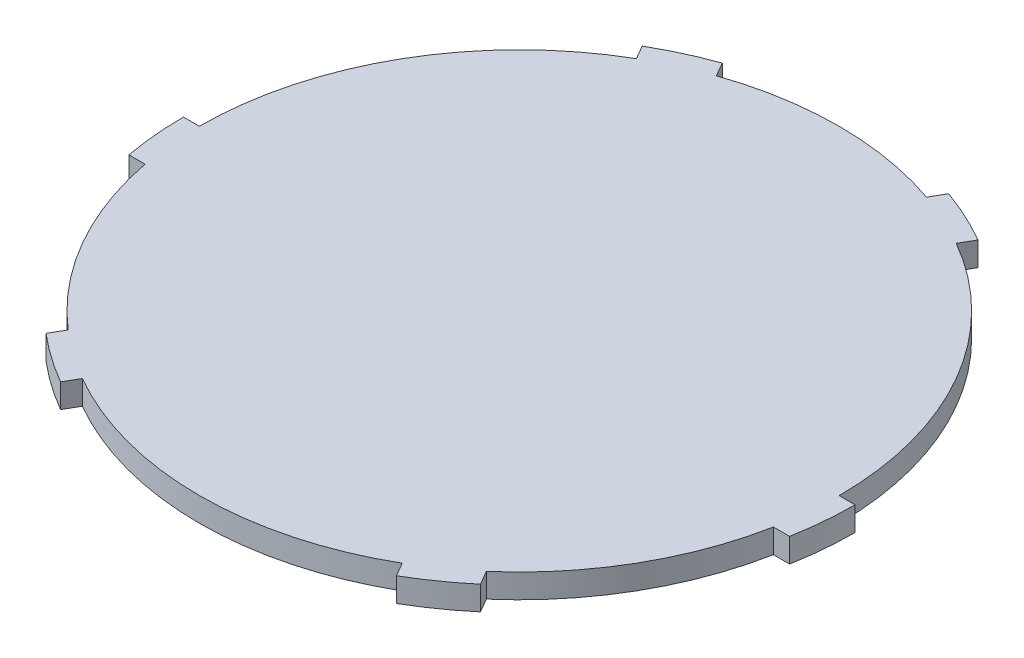
from build123d import *

# Parameters (mm, degrees)
BOSS_EXTRUDE1_DEPTH = 2
BOSS_EXTRUDE2_DEPTH = 2
CUT_EXTRUDE1_DEPTH  = 2
FILLET1_R           = 2
FILLET2_R           = 1


with BuildPart() as part:
    # Sketch1 → Boss-Extrude1 (new body)
    with BuildSketch(Plane(origin=(0, 0, 0), x_dir=(1, 0, 0), z_dir=(0, 1, 0))):
        with BuildLine():
            Line((13.311072252, 23.055453444), (13.974197662, 24.204020346))
            ThreePointArc((13.974197662, 24.204020346), (11.743873388, 25.361274397), (9.418625663, 26.313538185))
            Line((9.418625663, 26.313538185), (8.744070643, 25.145174619))
            ThreePointArc((8.744070643, 25.145174619), (0, 26.622144504), (-8.744070643, 25.145174619))
            Line((-8.744070643, 25.145174619), (-9.418625663, 26.313538185))
            ThreePointArc((-9.418625663, 26.313538185), (-11.743873388, 25.361274397), (-13.974197662, 24.204020346))
            Line((-13.974197662, 24.204020346), (-13.311072252, 23.055453444))
            ThreePointArc((-13.311072252, 23.055453444), (-23.055453444, 13.311072252), (-26.622144504, 0))
            Line((-26.622144504, 0), (-27.948395324, 0))
            ThreePointArc((-27.948395324, 0), (-27.835444594, -2.510144506), (-27.497505363, -5))
            Line((-27.497505363, -5), (-26.148395324, -5))
            ThreePointArc((-26.148395324, -5), (-23.055453444, -13.311072252), (-17.404324681, -20.145174619))
            Line((-17.404324681, -20.145174619), (-18.0788797, -21.313538185))
            ThreePointArc((-18.0788797, -21.313538185), (-16.091571206, -22.851129891), (-13.974197662, -24.204020346))
            Line((-13.974197662, -24.204020346), (-13.311072252, -23.055453444))
            ThreePointArc((-13.311072252, -23.055453444), (0, -26.622144504), (13.311072252, -23.055453444))
            Line((13.311072252, -23.055453444), (13.974197662, -24.204020346))
            ThreePointArc((13.974197662, -24.204020346), (16.091571206, -22.851129891), (18.0788797, -21.313538185))
            Line((18.0788797, -21.313538185), (17.404324681, -20.145174619))
            ThreePointArc((17.404324681, -20.145174619), (23.055453444, -13.311072252), (26.148395324, -5))
            Line((26.148395324, -5), (27.497505363, -5))
            ThreePointArc((27.497505363, -5), (27.835444594, -2.510144506), (27.948395324, 0))
            Line((27.948395324, 0), (26.622144504, 0))
            ThreePointArc((26.622144504, 0), (23.055453444, 13.311072252), (13.311072252, 23.055453444))
        make_face()
    extrude(amount=BOSS_EXTRUDE1_DEPTH)

    # Sketch2 → Boss-Extrude2 (add)
    with BuildSketch(Plane.XZ):
        with BuildLine():
            Line((-5.8, -25.737204514), (5.8, -25.737204514))
            Line((5.8, -25.737204514), (5.8, -21.3))
            Line((5.8, -21.3), (7.903128058, -21.3))
            ThreePointArc((7.903128058, -21.3), (9.07834188, -21.768068718), (10.339619988, -21.671149242))
            ThreePointArc((10.339619988, -21.671149242), (11.075305639, -21.469795949), (11.823980776, -21.323980776))
            ThreePointArc((11.823980776, -21.323980776), (11.969795949, -20.575305639), (12.171149242, -19.839619988))
            ThreePointArc((12.171149242, -19.839619988), (12.268068718, -18.57834188), (11.8, -17.403128058))
            Line((11.8, -17.403128058), (11.8, 16.3))
            Line((11.8, 16.3), (-11.8, 16.3))
            Line((-11.8, 16.3), (-11.8, -0.5))
            ThreePointArc((-11.8, -0.5), (-13.323044738, -4.176955262), (-17, -5.7))
            Line((-17, -5.7), (-19.8, -5.7))
            Line((-19.8, -5.7), (-19.8, -15.3))
            Line((-19.8, -15.3), (-13, -15.3))
            ThreePointArc((-13, -15.3), (-12.151471863, -15.651471863), (-11.8, -16.5))
            Line((-11.8, -16.5), (-11.8, -17.563099043))
            ThreePointArc((-11.8, -17.563099043), (-12.3, -19.159970985), (-11.8, -20.756842927))
            Line((-11.8, -20.756842927), (-11.8, -21.343991953))
            ThreePointArc((-11.8, -21.343991953), (-11.166576007, -21.530222711), (-10.546527145, -21.757042593))
            ThreePointArc((-10.546527145, -21.757042593), (-9.056966413, -21.924699044), (-7.694376613, -21.3))
            Line((-7.694376613, -21.3), (-5.8, -21.3))
            Line((-5.8, -21.3), (-5.8, -25.737204514))
        make_face()
    extrude(amount=BOSS_EXTRUDE2_DEPTH)

    # Sketch4 → Cut-Extrude1 (cut)
    with BuildSketch(Plane.XZ.offset(2)):
        with BuildLine():
            Line((-4.3, -19.8), (-4.3, -24.237204514))
            Line((-4.3, -24.237204514), (4.3, -24.237204514))
            Line((4.3, -24.237204514), (4.3, -19.8))
            Line((4.3, -19.8), (8.475304923, -19.8))
            ThreePointArc((8.475304923, -19.8), (9.113730299, -20.241287927), (9.889823566, -20.240176434))
            ThreePointArc((9.889823566, -20.240176434), (10.220030244, -20.141701714), (10.552993589, -20.052993589))
            ThreePointArc((10.552993589, -20.052993589), (10.641701714, -19.720030244), (10.740176434, -19.389823566))
            ThreePointArc((10.740176434, -19.389823566), (10.741287927, -18.613730299), (10.3, -17.975304923))
            Line((10.3, -17.975304923), (10.3, 14.8))
            Line((10.3, 14.8), (-10.3, 14.8))
            Line((-10.3, 14.8), (-10.3, -0.5))
            ThreePointArc((-10.3, -0.5), (-12.262384566, -5.237615434), (-17, -7.2))
            Line((-17, -7.2), (-18.3, -7.2))
            Line((-18.3, -7.2), (-18.3, -13.8))
            Line((-18.3, -13.8), (-13, -13.8))
            ThreePointArc((-13, -13.8), (-11.090811691, -14.590811691), (-10.3, -16.5))
            Line((-10.3, -16.5), (-10.3, -18.135275908))
            ThreePointArc((-10.3, -18.135275908), (-10.8, -19.159970985), (-10.3, -20.184666062))
            Line((-10.3, -20.184666062), (-10.3, -20.244402637))
            ThreePointArc((-10.3, -20.244402637), (-10.1425072, -20.303948315), (-9.985887603, -20.365754231))
            ThreePointArc((-9.985887603, -20.365754231), (-9.070775843, -20.387067812), (-8.368468799, -19.8))
            Line((-8.368468799, -19.8), (-4.3, -19.8))
        make_face()
    extrude(amount=-CUT_EXTRUDE1_DEPTH, mode=Mode.SUBTRACT)

    # Fillet1
    # the kernel refuses this fillet: 2 mm, written as the material it takes off along each edge
    with BuildSketch(Plane(origin=(11.823980776, 0, -21.323980776), x_dir=(0.21089533444820466, 0, 0.977508648508022), z_dir=(0, -1, 0))) as fillet1_piece_1:
        with BuildLine():
            CenterArc((1.288021457, 1.996690902), FILLET1_R, 207.646032977, 59.057586609)
            Line((-0.48364068, 1.068675131), (-0.519073923, 1.050114816))
            ThreePointArc((-0.519073923, 1.050114816), (-0.262887012, 0.524803612), (-0.037329873, -0.014369433))
            Line((-0.037329873, -0.014369433), (0.002300038, -0.039933818))
            ThreePointArc((0.002300038, -0.039933818), (0.586509771, -0.023123602), (1.170719503, -0.039933818))
            Line((1.170719503, -0.039933818), (1.173019541, 0))
        make_face()
    extrude(amount=4.932548853, mode=Mode.SUBTRACT)
    with BuildSketch(Plane(origin=(-11.8, 0, -21.343991953), x_dir=(0.9530196078830334, 0, -0.3029086116149048), z_dir=(0, -1, 0))) as fillet1_piece_2:
        with BuildLine():
            CenterArc((1.212682202, 1.99706697), FILLET1_R, 225.951474685, 40.945152222)
            Line((-0.177852496, 0.559564534), (-0.20566319, 0.530814485))
            ThreePointArc((-0.20566319, 0.530814485), (-0.127047032, 0.267665923), (-0.038120784, -0.012116344))
            Line((-0.038120784, -0.012116344), (0.002165504, -0.039941339))
            ThreePointArc((0.002165504, -0.039941339), (0.552203503, -0.025041546), (1.102241502, -0.039941339))
            Line((1.102241502, -0.039941339), (1.104407006, 0))
        make_face()
    extrude(amount=4.761017514, mode=Mode.SUBTRACT)

    # Fillet2
    fillet2_edges = [part.edges().sort_by_distance(p)[0] for p in [
        (-5.8, -1, -25.737204514),
        (5.8, -1, -25.737204514),
        (11.8, -1, 16.3),
        (-11.8, -1, 16.3),
        (-19.8, -1, -5.7),
        (-19.8, -1, -15.3),
    ]]
    fillet(fillet2_edges, radius=FILLET2_R)


solid = part.part
